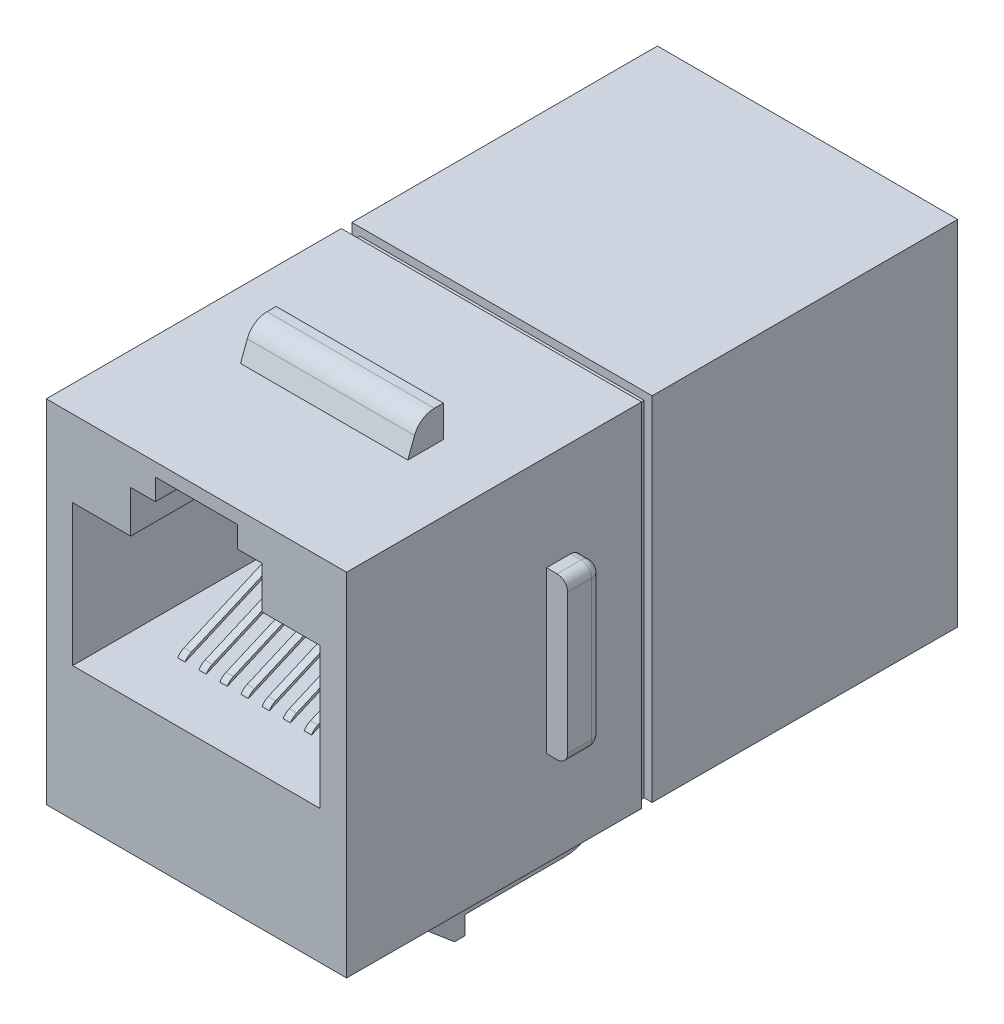
from build123d import *

# Parameters (mm, degrees)
BOSS_EXTRUDE1_DEPTH      = 7.239
BOSS_EXTRUDE1_DEPTH_BACK = 7.239
BOSS_EXTRUDE2_DEPTH      = 4.03225
BOSS_EXTRUDE2_DEPTH_BACK = 4.03225
BOSS_EXTRUDE3_DEPTH      = 5.08
CUT_EXTRUDE1_DEPTH       = 9.8933
BOSS_EXTRUDE6_START      = -3.4036
BOSS_EXTRUDE6_DEPTH      = 0.3556
FILLET5_R                = 0.635
LPATTERN1_COUNT          = 8
LPATTERN1_PITCH          = 1.016
CUT_EXTRUDE4_DEPTH       = 20.68100524
CUT_EXTRUDE4_DEPTH_BACK  = 20.68100524
CUT_EXTRUDE2_DEPTH       = 0.508
BOSS_EXTRUDE7_DEPTH      = 1.016
FILLET4_R                = 0.508
FILLET4_OF_MIRROR1_R     = 0.508
CUT_EXTRUDE3_DEPTH       = 21.076948753
CUT_EXTRUDE3_DEPTH_BACK  = 21.076948753


with BuildPart() as part:
    # Sketch3 → Boss-Extrude1 (new, two sides: drawn at the far end of the back side and taken through both)
    with BuildSketch(Plane(origin=(0, 0, 0), x_dir=(0, 0, -1), z_dir=(1, 0, 0)).offset(-BOSS_EXTRUDE1_DEPTH_BACK)):
        Polygon((-14.732, 9.3345), (14.732, 9.3345), (14.732, -7.6835), (-14.732, -7.6073), align=None)
    extrude(amount=BOSS_EXTRUDE1_DEPTH + BOSS_EXTRUDE1_DEPTH_BACK)

    # Sketch4 → Boss-Extrude2 (add, two sides: drawn at the far end of the back side and taken through both)
    with BuildSketch(Plane(origin=(0, 0, 0), x_dir=(0, 0, -1), z_dir=(1, 0, 0)).offset(-BOSS_EXTRUDE2_DEPTH_BACK)):
        with BuildLine():
            Line((-8.248458452, 10.199811204), (-8.5852, 9.303467258))
            Line((-8.5852, 9.303467258), (-6.858, 9.318540304))
            Line((-6.858, 9.318540304), (-6.858, 10.8585))
            Line((-6.858, 10.8585), (-7.297361872, 10.8585))
            ThreePointArc((-7.297361872, 10.8585), (-7.875820089, 10.677749718), (-8.248458452, 10.199811204))
        make_face()
    extrude(amount=BOSS_EXTRUDE2_DEPTH + BOSS_EXTRUDE2_DEPTH_BACK)

    # Sketch5 → Boss-Extrude3 (add, symmetric)
    with BuildSketch(Plane(origin=(0, 0, 0), x_dir=(0, 0, -1), z_dir=(1, 0, 0))):
        with BuildLine():
            Line((-6.858, -9.9695), (-6.858, -10.8585))
            Line((-6.858, -10.8585), (-7.2771, -10.8585))
            ThreePointArc((-7.2771, -10.8585), (-7.364741212, -10.842900961), (-7.441617709, -10.798019827))
            Line((-7.441617709, -10.798019827), (-8.931720376, -9.531233467))
            ThreePointArc((-8.931720376, -9.531233467), (-8.997749298, -9.444316881), (-9.021202667, -9.33771364))
            Line((-9.021202667, -9.33771364), (-9.021202667, -9.194657825))
            ThreePointArc((-9.021202667, -9.194657825), (-8.949787336, -9.018082519), (-8.7757, -8.9408))
            Line((-8.7757, -8.9408), (-2.7051, -8.7376))
            ThreePointArc((-2.7051, -8.7376), (-2.008360661, -8.428296793), (-1.72253935, -7.7216))
            Line((-1.72253935, -7.7216), (-1.72253935, -7.640945157))
            Line((-1.72253935, -7.640945157), (0.2032, -7.645925517))
            Line((0.2032, -7.645925517), (0.2032, -7.6835))
            ThreePointArc((0.2032, -7.6835), (-0.466353898, -9.299946102), (-2.0828, -9.9695))
            Line((-2.0828, -9.9695), (-6.858, -9.9695))
        make_face()
    extrude(amount=BOSS_EXTRUDE3_DEPTH, both=True)

    # Sketch6 → Cut-Extrude1 (cut)
    with BuildSketch(Plane.XY.offset(14.732)):
        Polygon((-5.969, 5.6388), (-5.969, -1.1684), (5.969, -1.1684), (5.969, 5.6388), (3.16865, 5.6388), (3.16865, 7.6708), (-3.16865, 7.6708), (-3.16865, 5.6388), align=None)
    cut_extrude1 = extrude(amount=-CUT_EXTRUDE1_DEPTH, mode=Mode.SUBTRACT)

    # Sketch22 → Cut-Extrude4 (cut, two sides: drawn at the far end of the back side and taken through both)
    with BuildSketch(Plane.XY.offset(-CUT_EXTRUDE4_DEPTH_BACK)):
        Polygon((-3.2766, -0.4064), (-2.8194, -0.4064), (-2.8194, 2.1336), (-2.2606, 2.1336), (-2.2606, -0.4064), (-1.8034, -0.4064), (-1.8034, 2.1336), (-1.2446, 2.1336), (-1.2446, -0.4064), (-0.7874, -0.4064), (-0.7874, 2.1336), (-0.2286, 2.1336), (-0.2286, -0.4064), (0.2286, -0.4064), (0.2286, 2.1336), (0.7874, 2.1336), (0.7874, -0.4064), (1.2446, -0.4064), (1.2446, 2.1336), (1.8034, 2.1336), (1.8034, -0.4064), (2.2606, -0.4064), (2.2606, 2.1336), (2.8194, 2.1336), (2.8194, -0.4064), (3.2766, -0.4064), (3.2766, 2.1336), (3.8354, 2.1336), (3.8354, -0.4064), (5.969, -0.4064), (5.969, -1.1684), (-5.969, -1.1684), (-5.969, -0.4064), (-3.8354, -0.4064), (-3.8354, 2.1336), (-3.2766, 2.1336), align=None)
    extrude(amount=CUT_EXTRUDE4_DEPTH + CUT_EXTRUDE4_DEPTH_BACK, mode=Mode.SUBTRACT)

    # Sketch19 → Cut-Extrude2 (cut)
    with BuildSketch(Plane.XY):
        Polygon((7.239, 9.3345), (7.239, -7.6073), (7.239, -7.9883), (6.858, -7.9883), (6.858, -7.6073), (6.858, 8.9535), (-6.858, 8.9535), (-6.858, -7.6073), (-6.858, -7.9883), (-7.239, -7.9883), (-7.239, -7.6073), (-7.239, 9.3345), align=None)
    extrude(amount=CUT_EXTRUDE2_DEPTH, mode=Mode.SUBTRACT)

    # Sketch20 → Boss-Extrude7 (add)
    with BuildSketch(Plane(origin=(7.239, 0, 0), x_dir=(0, 0, -1), z_dir=(1, 0, 0))):
        with BuildLine():
            Line((-5.0927, -3.057201198), (-3.937, -3.057201198))
            ThreePointArc((-3.937, -3.057201198), (-3.577789755, -2.908411443), (-3.429, -2.549201198))
            Line((-3.429, -2.549201198), (-3.429, 4.194498802))
            ThreePointArc((-3.429, 4.194498802), (-3.577789755, 4.553709047), (-3.937, 4.702498802))
            Line((-3.937, 4.702498802), (-5.0927, 4.702498802))
            Line((-5.0927, 4.702498802), (-5.0927, -3.057201198))
        make_face()
    boss_extrude7 = extrude(amount=BOSS_EXTRUDE7_DEPTH)

    # Fillet4
    fillet4_edges = [part.edges().sort_by_distance(p)[0] for p in [
        (8.255, -2.908411443, 3.577789755),
        (8.255, 0.822648802, 3.429),
        (8.255, 4.553709047, 3.577789755),
        (8.255, 4.702498802, 4.51485),
        (8.255, -3.057201198, 4.51485),
    ]]
    fillet(fillet4_edges, radius=FILLET4_R)

    # Mirror1: Boss-Extrude7 across plane
    add(boss_extrude7.mirror(Plane(origin=(0, 0, 0), x_dir=(0, 0, 1), z_dir=(1, 0, 0))))

    # Fillet4 of Mirror1
    fillet4_of_mirror1_edges = [part.edges().sort_by_distance(p)[0] for p in [
        (-8.255, -2.908411443, 3.577789755),
        (-8.255, 0.822648802, 3.429),
        (-8.255, 4.553709047, 3.577789755),
        (-8.255, 4.702498802, 4.51485),
        (-8.255, -3.057201198, 4.51485),
    ]]
    fillet(fillet4_of_mirror1_edges, radius=FILLET4_OF_MIRROR1_R)

    # Mirror2: Cut-Extrude1 across plane
    add(cut_extrude1.mirror(Plane.XY), mode=Mode.SUBTRACT)

    # Sketch21 → Cut-Extrude3 (cut, two sides: drawn at the far end of the back side and taken through both)
    with BuildSketch(Plane.XY.offset(-CUT_EXTRUDE3_DEPTH_BACK)):
        Polygon((-3.16865, 5.6388), (3.16865, 5.6388), (3.16865, 7.6708), (1.9812, 7.6708), (1.9812, 8.6995), (-1.9812, 8.6995), (-1.9812, 7.6708), (-3.16865, 7.6708), align=None)
    extrude(amount=CUT_EXTRUDE3_DEPTH + CUT_EXTRUDE3_DEPTH_BACK, mode=Mode.SUBTRACT)


with BuildPart() as body_2:
    # Sketch18 → Boss-Extrude6 (new body)
    with BuildSketch(Plane(origin=(0, 0, 0), x_dir=(0, 0, -1), z_dir=(1, 0, 0)).offset(BOSS_EXTRUDE6_START)):
        Polygon((-12.192, -1.1684), (-2.032, 3.234266667), (-2.032, 3.09585544), (-11.872589476, -1.1684), align=None)
    extrude(amount=-BOSS_EXTRUDE6_DEPTH)

    # Fillet5
    # the kernel refuses this fillet: 0.635 mm, written as the material it takes off along each edge
    with BuildSketch(Plane(origin=(-1.718407692, -1.1684, 12.192), x_dir=(0, 0.39760743763430034, -0.9175556253099242), z_dir=(-1, 0, 0))) as fillet5_piece_1:
        with BuildLine():
            CenterArc((0.674076923, 0.635), FILLET5_R, 233.130102354, 36.869897646)
            Line((0.293076923, 0.127), (0, 0))
            Line((0, 0), (0.674076923, 0))
        make_face()
    extrude(amount=3.725984615, mode=Mode.SUBTRACT)


with BuildPart() as lpattern1_1:
    # LPattern1: pattern copy
    add(body_2.part.moved(Location(Vector(1, 0, 0) * (1 * LPATTERN1_PITCH))))


with BuildPart() as lpattern1_2:
    # LPattern1: pattern copy
    add(body_2.part.moved(Location(Vector(1, 0, 0) * (2 * LPATTERN1_PITCH))))


with BuildPart() as lpattern1_3:
    # LPattern1: pattern copy
    add(body_2.part.moved(Location(Vector(1, 0, 0) * (3 * LPATTERN1_PITCH))))


with BuildPart() as lpattern1_4:
    # LPattern1: pattern copy
    add(body_2.part.moved(Location(Vector(1, 0, 0) * (4 * LPATTERN1_PITCH))))


with BuildPart() as lpattern1_5:
    # LPattern1: pattern copy
    add(body_2.part.moved(Location(Vector(1, 0, 0) * (5 * LPATTERN1_PITCH))))


with BuildPart() as lpattern1_6:
    # LPattern1: pattern copy
    add(body_2.part.moved(Location(Vector(1, 0, 0) * (6 * LPATTERN1_PITCH))))


with BuildPart() as lpattern1_7:
    # LPattern1: pattern copy
    add(body_2.part.moved(Location(Vector(1, 0, 0) * (7 * LPATTERN1_PITCH))))


with BuildPart() as body_10:
    # Mirror3: mirrored copy
    add(lpattern1_4.part.mirror(Plane.XY))


with BuildPart() as body_11:
    # Mirror3 2: mirrored copy
    add(lpattern1_3.part.mirror(Plane.XY))


with BuildPart() as body_12:
    # Mirror3 3: mirrored copy
    add(lpattern1_2.part.mirror(Plane.XY))


with BuildPart() as body_13:
    # Mirror3 4: mirrored copy
    add(lpattern1_1.part.mirror(Plane.XY))


with BuildPart() as body_14:
    # Mirror3 5: mirrored copy
    add(body_2.part.mirror(Plane.XY))


with BuildPart() as body_15:
    # Mirror3 6: mirrored copy
    add(lpattern1_5.part.mirror(Plane.XY))


with BuildPart() as body_16:
    # Mirror3 7: mirrored copy
    add(lpattern1_6.part.mirror(Plane.XY))


with BuildPart() as body_17:
    # Mirror3 8: mirrored copy
    add(lpattern1_7.part.mirror(Plane.XY))


solid = Compound([part.part, body_2.part, lpattern1_1.part, lpattern1_2.part, lpattern1_3.part, lpattern1_4.part, lpattern1_5.part, lpattern1_6.part, lpattern1_7.part, body_10.part, body_11.part, body_12.part, body_13.part, body_14.part, body_15.part, body_16.part, body_17.part])
